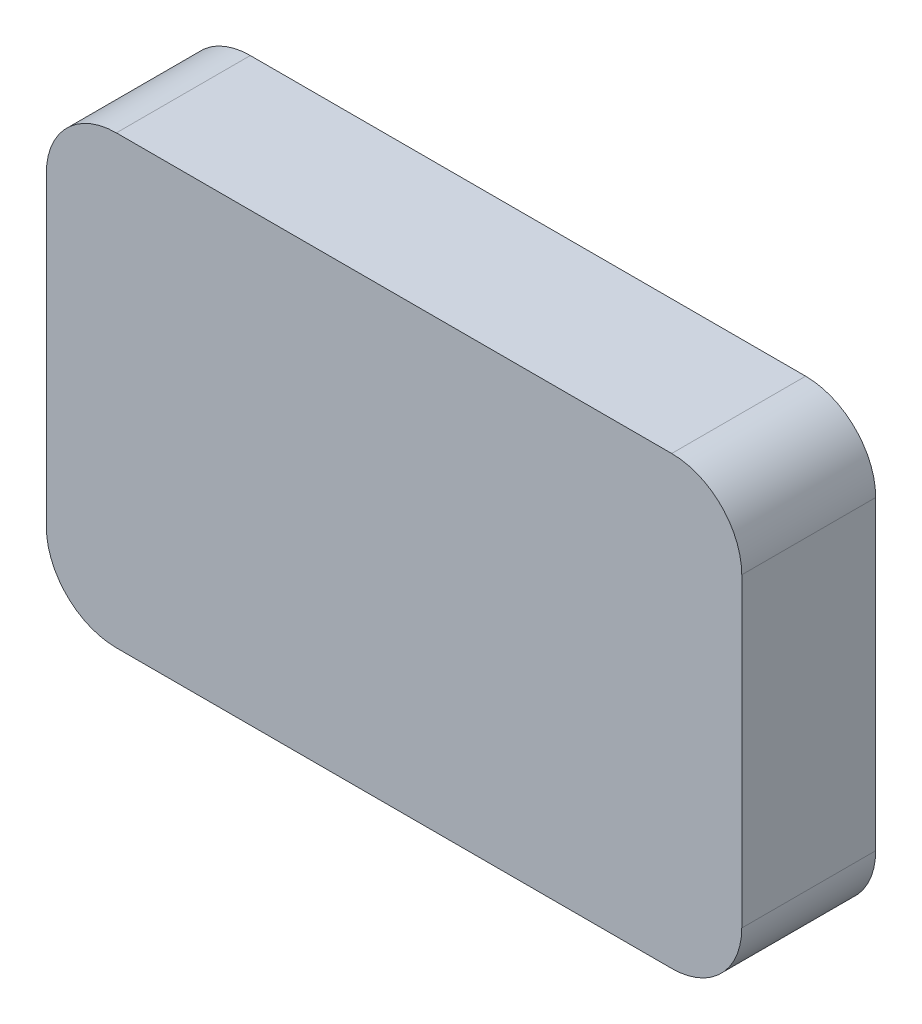
from build123d import *

# Parameters (mm, degrees)
BOSS_EXTRU_1_DEPTH = 1.2
CONG_1_R           = 2


with BuildPart() as part:
    # Balayage1: sweep along a path in Esquisse1
    with BuildLine(Plane.XY) as balayage1_path:
        Line((-39.634177347, 31.830613733), (39.634177347, 31.830613733))
        ThreePointArc((39.634177347, 31.830613733), (46.705245159, 28.901681545), (49.634177347, 21.830613733))
        Line((49.634177347, 21.830613733), (49.634177347, -21.830613733))
        ThreePointArc((49.634177347, -21.830613733), (46.705245159, -28.901681545), (39.634177347, -31.830613733))
        Line((39.634177347, -31.830613733), (-39.634177347, -31.830613733))
        ThreePointArc((-39.634177347, -31.830613733), (-46.705245159, -28.901681545), (-49.634177347, -21.830613733))
        Line((-49.634177347, -21.830613733), (-49.634177347, 21.830613733))
        ThreePointArc((-49.634177347, 21.830613733), (-46.705245159, 28.901681545), (-39.634177347, 31.830613733))
    # profil → Balayage1 (sweep)
    with BuildSketch(Plane(origin=(0, 0, 0), x_dir=(0, 0, -1), z_dir=(1, 0, 0))):
        with BuildLine():
            Line((0, -30.230613733), (9.122494235, -30.230613733))
            Line((9.122494235, -30.230613733), (17.918249503, -25.630613733))
            Line((17.918249503, -25.630613733), (17.918249503, -27.230613733))
            ThreePointArc((17.918249503, -27.230613733), (16.418249503, -28.730613733), (17.918249503, -30.230613733))
            Line((17.918249503, -30.230613733), (17.918249503, -31.830613733))
            Line((17.918249503, -31.830613733), (0, -31.830613733))
            Line((0, -31.830613733), (0, -30.230613733))
        make_face()
    sweep(path=balayage1_path.line)

    # Esquisse1<3> → Boss.-Extru.1 (add)
    with BuildSketch(Plane.XY):
        with BuildLine():
            Line((-39.634177347, 31.830613733), (39.634177347, 31.830613733))
            ThreePointArc((39.634177347, 31.830613733), (46.705245159, 28.901681545), (49.634177347, 21.830613733))
            Line((49.634177347, 21.830613733), (49.634177347, -21.830613733))
            ThreePointArc((49.634177347, -21.830613733), (46.705245159, -28.901681545), (39.634177347, -31.830613733))
            Line((39.634177347, -31.830613733), (-39.634177347, -31.830613733))
            ThreePointArc((-39.634177347, -31.830613733), (-46.705245159, -28.901681545), (-49.634177347, -21.830613733))
            Line((-49.634177347, -21.830613733), (-49.634177347, 21.830613733))
            ThreePointArc((-49.634177347, 21.830613733), (-46.705245159, 28.901681545), (-39.634177347, 31.830613733))
        make_face()
    extrude(amount=BOSS_EXTRU_1_DEPTH)

    # Congé1
    cong_1_edges = [part.edges().sort_by_distance(p)[0] for p in [
        (-45.573874309, 27.770310695, 0),
        (-48.034177347, 0, 0),
        (-45.573874309, -27.770310695, 0),
        (0, -30.230613733, 0),
        (0, -30.230613733, 0),
        (45.573874309, -27.770310695, 0),
        (48.034177347, 0, 0),
        (45.573874309, 27.770310695, 0),
        (0, 30.230613733, 0),
    ]]
    fillet(cong_1_edges, radius=CONG_1_R)


solid = part.part
